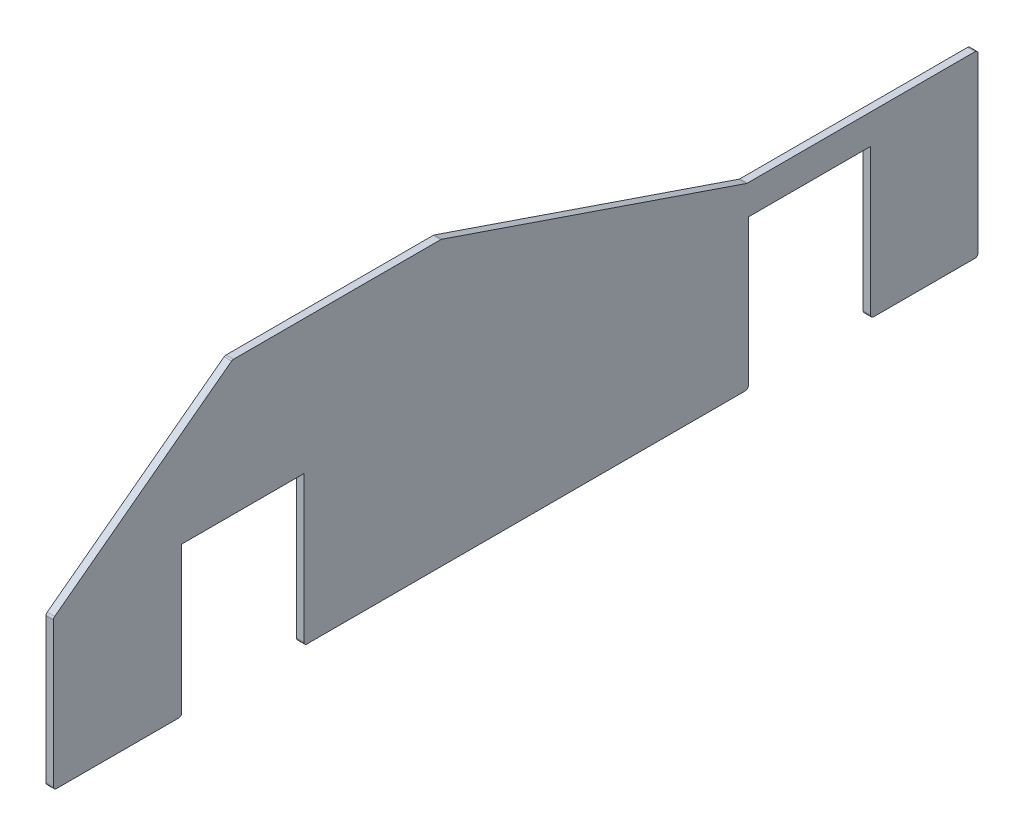
from build123d import *

# Parameters (mm, degrees)
SKETCH1_W           = 620
SKETCH1_H           = 190
BOSS_EXTRUDE1_DEPTH = 5
SKETCH2_W           = 82
SKETCH2_H           = 100
CUT_EXTRUDE1_DEPTH  = 5
FILLET1_R           = 2


with BuildPart() as part:
    # Sketch1 → Boss-Extrude1 (new body)
    with BuildSketch(Plane(origin=(0, 0, 0), x_dir=(0, 0, -1), z_dir=(1, 0, 0))):
        Rectangle(SKETCH1_W, SKETCH1_H)
    extrude(amount=BOSS_EXTRUDE1_DEPTH)

    # Sketch2 → Cut-Extrude1 (cut)
    with BuildSketch(Plane(origin=(5, 0, 0), x_dir=(0, 0, -1), z_dir=(1, 0, 0))):
        with Locations((-183, -45)):
            Rectangle(SKETCH2_W, SKETCH2_H)
        with Locations((197, -45)):
            Rectangle(SKETCH2_W, SKETCH2_H)
        Polygon((-310, 95), (-310, 5), (-190, 95), align=None)
        Polygon((310, 95), (-50, 95), (155, 25), (310, 25), align=None)
    extrude(amount=-CUT_EXTRUDE1_DEPTH, mode=Mode.SUBTRACT)

    # Fillet1
    fillet1_edges = [part.edges().sort_by_distance(p)[0] for p in [
        (2.5, 95, 50),
        (2.5, 5, 310),
        (2.5, -95, 310),
        (2.5, -95, 224),
        (2.5, -95, 142),
        (2.5, -95, -156),
        (2.5, -95, -238),
        (2.5, -95, -310),
        (2.5, 25, -310),
        (2.5, 25, -155),
        (2.5, 95, 190),
    ]]
    fillet(fillet1_edges, radius=FILLET1_R)


solid = part.part
